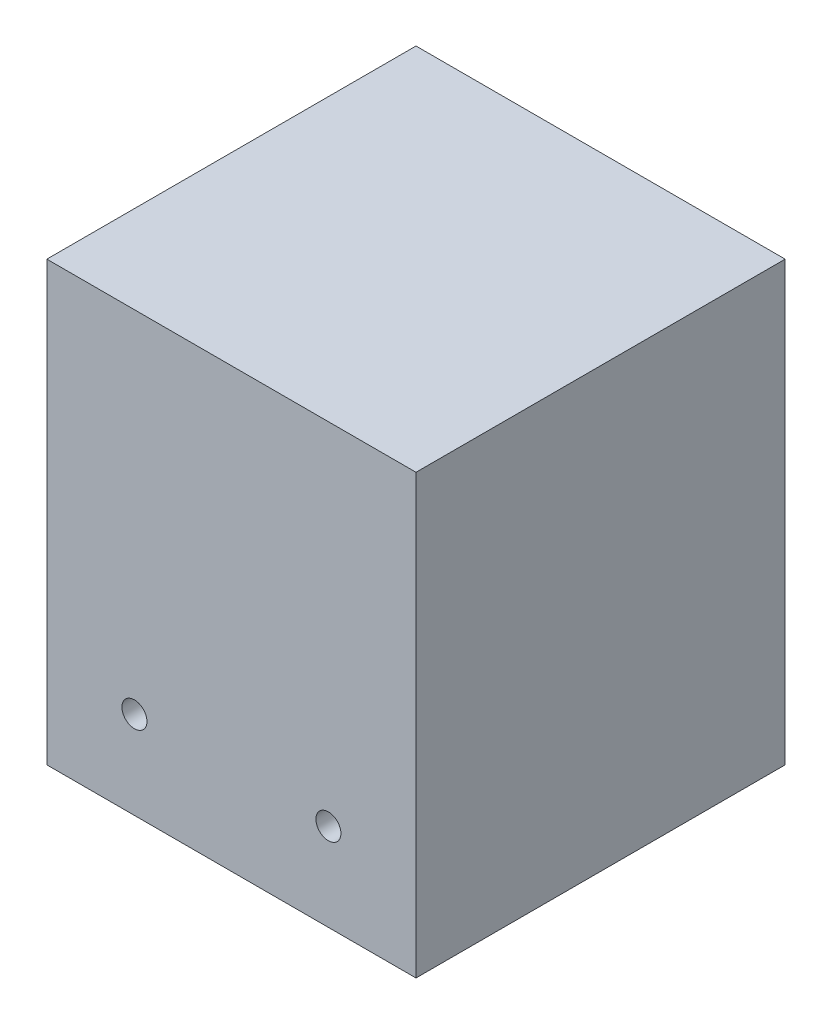
from build123d import *

# Parameters (mm, degrees)
ESQUISSE1_W             = 59
ESQUISSE1_H             = 59
BOSS_EXTRU_1_DEPTH      = 70
ENL_V_MAT_EXTRU_1_REACH = 98.248
ESQUISSE2_R             = 2


with BuildPart() as part:
    # Esquisse1 → Boss.-Extru.1 (new body)
    with BuildSketch(Plane(origin=(0, 0, 0), x_dir=(1, 0, 0), z_dir=(0, 1, 0))):
        with Locations((0.20896915, -12.058522539)):
            Rectangle(ESQUISSE1_W, ESQUISSE1_H)
    extrude(amount=BOSS_EXTRU_1_DEPTH)

    # Esquisse2 → Enlèv. mat.-Extru.1 (cut, up to next)
    with BuildSketch(Plane.XY.offset(41.558522539), mode=Mode.PRIVATE) as enl_v_mat_extru_1_sk1:
        with Locations((-15.29103085, 14)):
            Circle(ESQUISSE2_R)
    enl_v_mat_extru_1_tool1 = extrude(enl_v_mat_extru_1_sk1.sketch, amount=-ENL_V_MAT_EXTRU_1_REACH, mode=Mode.PRIVATE) & part.part
    # Esquisse2 → Enlèv. mat.-Extru.1 (cut, up to next)
    with BuildSketch(Plane.XY.offset(41.558522539), mode=Mode.PRIVATE) as enl_v_mat_extru_1_sk2:
        with Locations((15.70896915, 14)):
            Circle(ESQUISSE2_R)
    enl_v_mat_extru_1_tool2 = extrude(enl_v_mat_extru_1_sk2.sketch, amount=-ENL_V_MAT_EXTRU_1_REACH, mode=Mode.PRIVATE) & part.part
    add(enl_v_mat_extru_1_tool1.solids().sort_by_distance((-15.291031, 14, 41.558523))[0], mode=Mode.SUBTRACT)
    add(enl_v_mat_extru_1_tool2.solids().sort_by_distance((15.708969, 14, 41.558523))[0], mode=Mode.SUBTRACT)


solid = part.part
